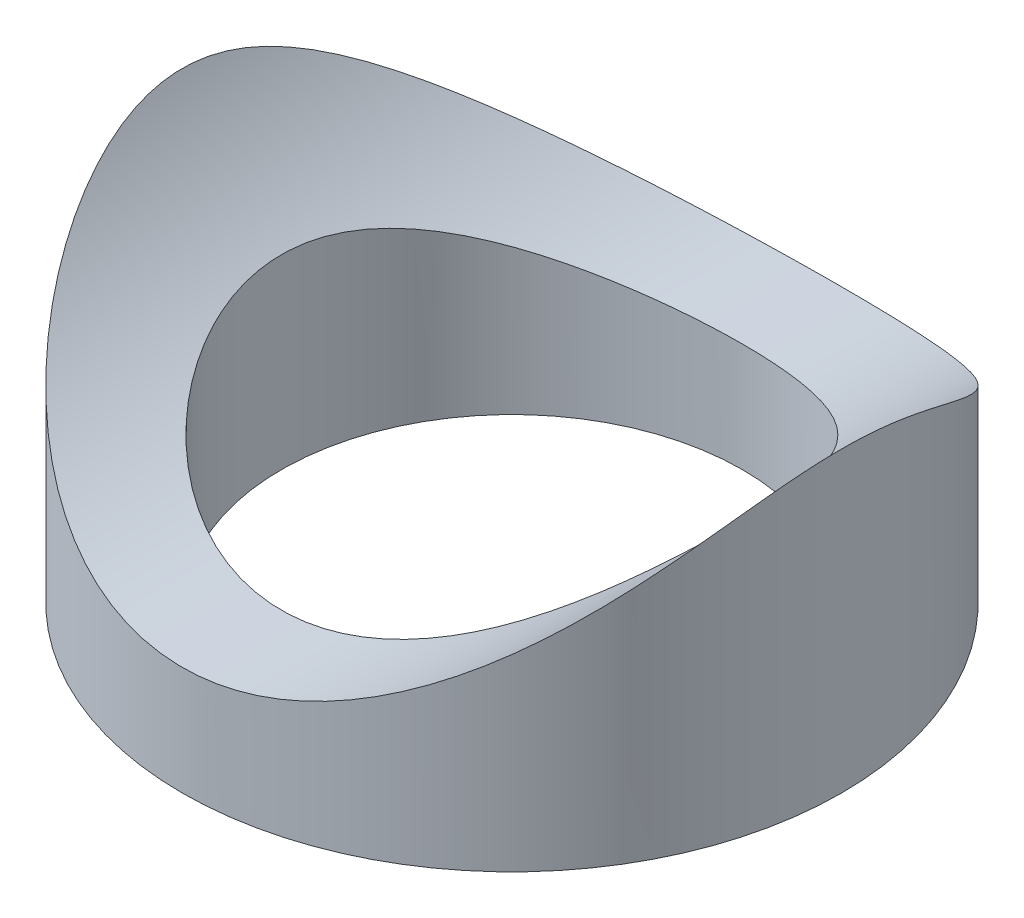
from build123d import *

# Parameters (mm, degrees)
SKETCH1_R               = 7.15
SKETCH1_R_2             = 5
BOSS_EXTRUDE1_DEPTH     = 10
CUT_EXTRUDE1_DEPTH      = 15.221286862
CUT_EXTRUDE1_DEPTH_BACK = 15.221286862
SKETCH2_R               = 8.28
BOSS_EXTRUDE2_START     = 1
SKETCH3_R               = 7.15
SKETCH3_R_2             = 5
BOSS_EXTRUDE2_DEPTH     = 1


with BuildPart() as part:
    # Sketch1 → Boss-Extrude1 (new body)
    with BuildSketch(Plane(origin=(0, 0, 0), x_dir=(1, 0, 0), z_dir=(0, 1, 0))):
        Circle(SKETCH1_R)
        Circle(SKETCH1_R_2, mode=Mode.SUBTRACT)
    extrude(amount=BOSS_EXTRUDE1_DEPTH)

    # Sketch2 → Cut-Extrude1 (cut, two sides: drawn at the far end of the back side and taken through both)
    with BuildSketch(Plane.XY.offset(-CUT_EXTRUDE1_DEPTH_BACK)):
        with Locations((0, 9.64)):
            Circle(SKETCH2_R)
    extrude(amount=CUT_EXTRUDE1_DEPTH + CUT_EXTRUDE1_DEPTH_BACK, mode=Mode.SUBTRACT)

    # Sketch3 → Boss-Extrude2 (add)
    with BuildSketch(Plane.XZ.offset(BOSS_EXTRUDE2_START)):
        Circle(SKETCH3_R)
        Circle(SKETCH3_R_2, mode=Mode.SUBTRACT)
    extrude(amount=-BOSS_EXTRUDE2_DEPTH)


solid = part.part
